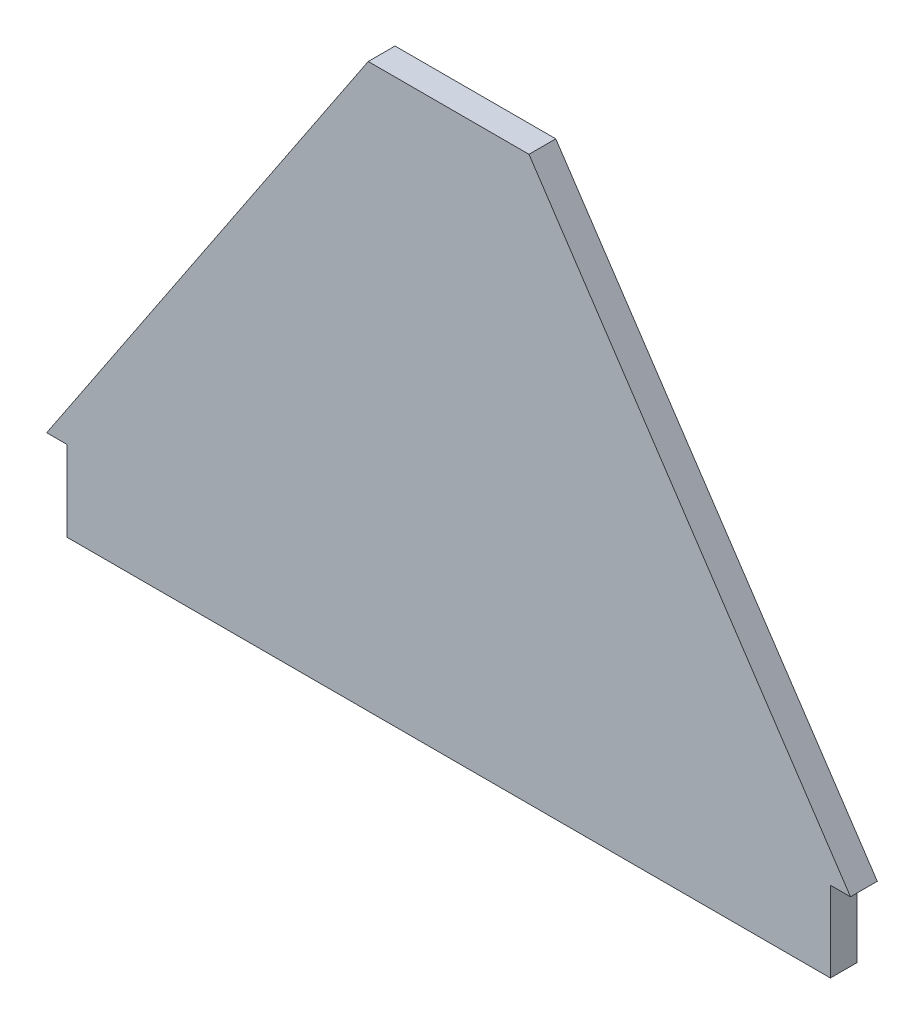
from build123d import *

# Parameters (mm, degrees)
BOSS_EXTRUDE1_DEPTH = 5


with BuildPart() as part:
    # Sketch1 → Boss-Extrude1 (new body)
    with BuildSketch(Plane.XY):
        Polygon((75, 11.725913897), (71.25, 11.725913897), (71.25, -3.274086103), (-71.25, -3.274086103), (-71.25, 11.725913897), (-75, 11.725913897), (-15, 101.725913897), (15, 101.725913897), align=None)
    extrude(amount=BOSS_EXTRUDE1_DEPTH)


solid = part.part
